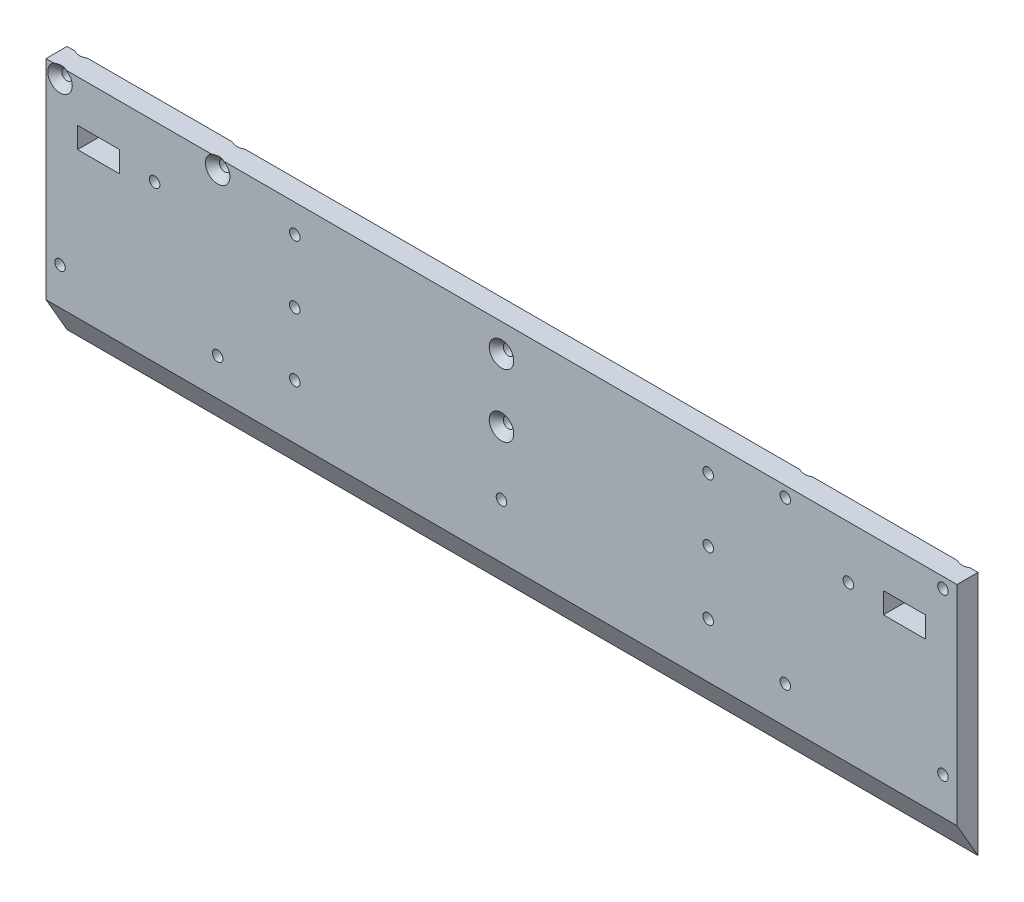
from build123d import *

# Parameters (mm, degrees)
SKETCH_1_W          = 260
SKETCH_1_H          = 70
EXTRUDE_1_DEPTH     = 6
CUT_EXTRUDE_1_DEPTH = 260
SKETCH_3_R          = 1.5
CUT_EXTRUDE_2_DEPTH = 10
SKETCH_4_R          = 1.5
CUT_EXTRUDE_3_DEPTH = 10
SKETCH_5_R          = 1.5
CUT_EXTRUDE_4_DEPTH = 33
SKETCH_6_R          = 1.5
SKETCH_6_W          = 12
SKETCH_6_H          = 6
CUT_EXTRUDE_5_DEPTH = 10
SKETCH_7_R          = 1.5
CUT_EXTRUDE_6_DEPTH = 10
CHAMFER_1_SIZE      = 2
CHAMFER_2_SIZE      = 2
CHAMFER_3_SIZE      = 2
CHAMFER_4_SIZE      = 2


with BuildPart() as part:
    # 草图1 → 凸台-拉伸1 (new body)
    with BuildSketch(Plane.XY):
        Rectangle(SKETCH_1_W, SKETCH_1_H)
    extrude(amount=EXTRUDE_1_DEPTH)

    # 草图2 → 切除-拉伸1 (cut)
    with BuildSketch(Plane(origin=(130, 0, 0), x_dir=(0, 0, -1), z_dir=(1, 0, 0))):
        Polygon((0, -35), (-6, -24.607695155), (-6, -35), align=None)
    extrude(amount=-CUT_EXTRUDE_1_DEPTH, mode=Mode.SUBTRACT)

    # 草图3 → 切除-拉伸2 (cut)
    with BuildSketch(Plane.XY.offset(6)):
        with Locations((-59, 9)):
            Circle(SKETCH_3_R)
        with Locations((59, 9)):
            Circle(SKETCH_3_R)
    extrude(amount=-CUT_EXTRUDE_2_DEPTH, mode=Mode.SUBTRACT)

    # 草图4 → 切除-拉伸3 (cut)
    with BuildSketch(Plane(origin=(0, 0, 0), x_dir=(-1, 0, 0), z_dir=(0, 0, -1))):
        with Locations((-59, 27)):
            Circle(SKETCH_4_R)
        with Locations((-59, -9)):
            Circle(SKETCH_4_R)
        with Locations((59, 27)):
            Circle(SKETCH_4_R)
        with Locations((59, -9)):
            Circle(SKETCH_4_R)
    extrude(amount=-CUT_EXTRUDE_3_DEPTH, mode=Mode.SUBTRACT)

    # 草图5 → 切除-拉伸4 (cut)
    with BuildSketch(Plane.XY.offset(6)):
        with Locations((0, 27)):
            Circle(SKETCH_5_R)
        with Locations((0, 9)):
            Circle(SKETCH_5_R)
        with Locations((0, -9)):
            Circle(SKETCH_5_R)
    extrude(amount=-CUT_EXTRUDE_4_DEPTH, mode=Mode.SUBTRACT)

    # 草图6 → 切除-拉伸5 (cut)
    with BuildSketch(Plane.XY.offset(6)):
        with Locations((-99, 20)):
            Circle(SKETCH_6_R)
        with Locations((-115, 20)):
            Rectangle(SKETCH_6_W, SKETCH_6_H)
    cut_extrude_5 = extrude(amount=-CUT_EXTRUDE_5_DEPTH, mode=Mode.SUBTRACT)

    # 镜向1: 切除-拉伸5 across plane
    add(cut_extrude_5.mirror(Plane(origin=(0, 0, 0), x_dir=(0, 0, 1), z_dir=(1, 0, 0))), mode=Mode.SUBTRACT)

    # 草图7 → 切除-拉伸6 (cut)
    with BuildSketch(Plane.XY.offset(6)):
        with Locations((-126, 32)):
            Circle(SKETCH_7_R)
        with Locations((-81, 32)):
            Circle(SKETCH_7_R)
        with Locations((-81, -14)):
            Circle(SKETCH_7_R)
        with Locations((-126, -14)):
            Circle(SKETCH_7_R)
    cut_extrude_6 = extrude(amount=-CUT_EXTRUDE_6_DEPTH, mode=Mode.SUBTRACT)

    # 镜向2: 切除-拉伸6 across plane
    add(cut_extrude_6.mirror(Plane(origin=(0, 0, 0), x_dir=(0, 0, 1), z_dir=(1, 0, 0))), mode=Mode.SUBTRACT)

    # 倒角1
    # the kernel refuses this chamfer: 2 mm, written as the material it takes off along each edge
    with BuildSketch(Plane(origin=(126, 32, 0), x_dir=(-1, 0, 0), z_dir=(0, 1, 0))) as chamfer_1_piece_1:
        Polygon((1.5 + CHAMFER_1_SIZE, 0), (1.5, CHAMFER_1_SIZE), (1.5, 0), align=None)
    revolve(axis=Axis((126, 32, 0), (0, 0, 1)), mode=Mode.SUBTRACT)

    # 倒角2
    # the kernel refuses this chamfer: 2 mm, written as the material it takes off along each edge
    with BuildSketch(Plane(origin=(-126, 32, 0), x_dir=(1, 0, 0), z_dir=(0, -1, 0))) as chamfer_2_piece_1:
        Polygon((1.5 + CHAMFER_2_SIZE, 0), (1.5, CHAMFER_2_SIZE), (1.5, 0), align=None)
    revolve(axis=Axis((-126, 32, 0), (0, 0, 1)), mode=Mode.SUBTRACT)
    with BuildSketch(Plane(origin=(-126, 32, 6), x_dir=(1, 0, 0), z_dir=(0, -1, 0))) as chamfer_2_piece_2:
        Polygon((1.5 + CHAMFER_2_SIZE, 0), (1.5, -CHAMFER_2_SIZE), (1.5, 0), align=None)
    revolve(axis=Axis((-126, 32, 6), (0, 0, 1)), mode=Mode.SUBTRACT)
    with BuildSketch(Plane(origin=(-81, 32, 0), x_dir=(1, 0, 0), z_dir=(0, -1, 0))) as chamfer_2_piece_3:
        Polygon((1.5 + CHAMFER_2_SIZE, 0), (1.5, CHAMFER_2_SIZE), (1.5, 0), align=None)
    revolve(axis=Axis((-81, 32, 0), (0, 0, 1)), mode=Mode.SUBTRACT)
    with BuildSketch(Plane(origin=(-81, 32, 6), x_dir=(1, 0, 0), z_dir=(0, -1, 0))) as chamfer_2_piece_4:
        Polygon((1.5 + CHAMFER_2_SIZE, 0), (1.5, -CHAMFER_2_SIZE), (1.5, 0), align=None)
    revolve(axis=Axis((-81, 32, 6), (0, 0, 1)), mode=Mode.SUBTRACT)
    with BuildSketch(Plane(origin=(81, 32, 0), x_dir=(-1, 0, 0), z_dir=(0, 1, 0))) as chamfer_2_piece_5:
        Polygon((1.5 + CHAMFER_2_SIZE, 0), (1.5, CHAMFER_2_SIZE), (1.5, 0), align=None)
    revolve(axis=Axis((81, 32, 0), (0, 0, 1)), mode=Mode.SUBTRACT)
    with BuildSketch(Plane(origin=(59, 27, 0), x_dir=(-1, 0, 0), z_dir=(0, -1, 0))) as chamfer_2_piece_6:
        Polygon((1.5 + CHAMFER_2_SIZE, 0), (1.5, -CHAMFER_2_SIZE), (1.5, 0), align=None)
    revolve(axis=Axis((59, 27, 0), (0, 0, -1)), mode=Mode.SUBTRACT)
    with BuildSketch(Plane(origin=(-59, 27, 0), x_dir=(-1, 0, 0), z_dir=(0, -1, 0))) as chamfer_2_piece_7:
        Polygon((1.5 + CHAMFER_2_SIZE, 0), (1.5, -CHAMFER_2_SIZE), (1.5, 0), align=None)
    revolve(axis=Axis((-59, 27, 0), (0, 0, -1)), mode=Mode.SUBTRACT)
    with BuildSketch(Plane(origin=(0, 27, 6), x_dir=(1, 0, 0), z_dir=(0, -1, 0))) as chamfer_2_piece_8:
        Polygon((1.5 + CHAMFER_2_SIZE, 0), (1.5, -CHAMFER_2_SIZE), (1.5, 0), align=None)
    revolve(axis=Axis((0, 27, 6), (0, 0, 1)), mode=Mode.SUBTRACT)

    # 倒角3
    chamfer_3_edges = [part.edges().sort_by_distance(p)[0] for p in [
        (-82.5, -14, 0),
        (-127.5, -14, 0),
        (-60.5, 9, 0),
        (57.5, 9, 0),
        (-57.5, -9, 0),
        (-1.5, 27, 0),
        (-1.5, 9, 0),
        (-1.5, 9, 6),
        (-1.5, -9, 0),
        (-100.5, 20, 0),
        (100.5, 20, 0),
    ]]
    chamfer(chamfer_3_edges, length=CHAMFER_3_SIZE)

    # 倒角4
    chamfer_4_edges = [part.edges().sort_by_distance(p)[0] for p in [
        (82.5, -14, 0),
        (127.5, -14, 0),
        (60.5, -9, 0),
    ]]
    chamfer(chamfer_4_edges, length=CHAMFER_4_SIZE)


solid = part.part
